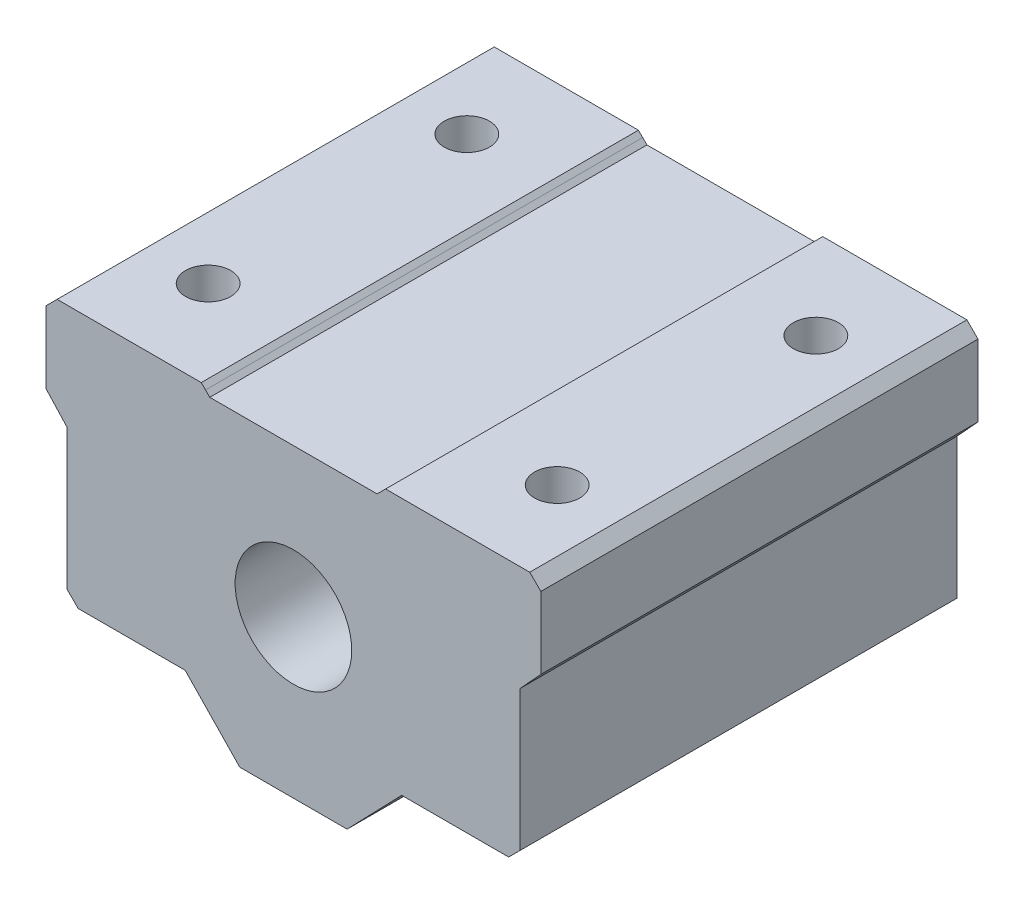
from build123d import *

# Parameters (mm, degrees)
SKETCH1_R           = 4
BOSS_EXTRUDE1_DEPTH = 30
SKETCH2_R           = 1.5494
CUT_EXTRUDE1_DEPTH  = 49.630200751
SKETCH3_W           = 12.065
SKETCH3_H           = 30
CUT_EXTRUDE2_DEPTH  = 0.5842
CHAMFER1_SIZE       = 0.2921
CUT_EXTRUDE3_DEPTH  = 51.171756524
CHAMFER2_SIZE       = 0.762


with BuildPart() as part:
    # Sketch1 → Boss-Extrude1 (new body)
    with BuildSketch(Plane.XY):
        Polygon((0, 0), (33.9598, 0), (33.9598, -17.653), (24.4094, -17.653), (20.6629, -21.5392), (13.2969, -21.5392), (9.5504, -17.653), (0, -17.653), align=None)
        with Locations((16.9799, -10.7696)):
            Circle(SKETCH1_R, mode=Mode.SUBTRACT)
    extrude(amount=BOSS_EXTRUDE1_DEPTH)

    # Sketch2 → Cut-Extrude1 (cut, through all)
    with BuildSketch(Plane(origin=(0, -17.653, 0), x_dir=(-1, 0, 0), z_dir=(0, -1, 0))):
        with Locations(Location((-5.0038, -23.8773, 0), (0, 0, 90))):
            Circle(SKETCH2_R)
        with Locations(Location((-5.0038, -6.1227, 0), (0, 0, 90))):
            Circle(SKETCH2_R)
        with Locations(Location((-28.956, -6.1227, 0), (0, 0, 90))):
            Circle(SKETCH2_R)
        with Locations(Location((-28.956, -23.8773, 0), (0, 0, 90))):
            Circle(SKETCH2_R)
    extrude(amount=-CUT_EXTRUDE1_DEPTH, mode=Mode.SUBTRACT)

    # Sketch3 → Cut-Extrude2 (cut)
    with BuildSketch(Plane(origin=(0, 0, 0), x_dir=(1, 0, 0), z_dir=(0, 1, 0))):
        with Locations((16.9799, -15)):
            Rectangle(SKETCH3_W, SKETCH3_H)
    extrude(amount=-CUT_EXTRUDE2_DEPTH, mode=Mode.SUBTRACT)

    # Chamfer1
    chamfer1_edges = [part.edges().sort_by_distance(p)[0] for p in [
        (23.0124, -0.5842, 15),
        (10.9474, -0.5842, 15),
    ]]
    chamfer(chamfer1_edges, length=CHAMFER1_SIZE)
    chamfer1_2_edges = [part.edges().sort_by_distance(p)[0] for p in [
        (23.0124, 0, 15),
        (10.9474, 0, 15),
    ]]
    chamfer(chamfer1_2_edges, length=CHAMFER1_SIZE - 0.0001)  # a hair under: the kernel refuses the full size

    # Sketch4 → Cut-Extrude3 (cut, through all)
    with BuildSketch(Plane.XY.offset(30)):
        Polygon((1.4478, -17.653), (1.4478, -7.2644), (0, -5.6896), (0, -17.653), align=None)
    cut_extrude3 = extrude(amount=-CUT_EXTRUDE3_DEPTH, mode=Mode.SUBTRACT)

    # Mirror1: Cut-Extrude3 across plane
    add(cut_extrude3.mirror(Plane.ZY.offset(-16.9799)), mode=Mode.SUBTRACT)

    # Chamfer2
    chamfer2_edges = [part.edges().sort_by_distance(p)[0] for p in [
        (32.512, -17.653, 15),
        (0, 0, 15),
        (33.9598, 0, 15),
        (1.4478, -17.653, 15),
    ]]
    chamfer(chamfer2_edges, length=CHAMFER2_SIZE)


solid = part.part
